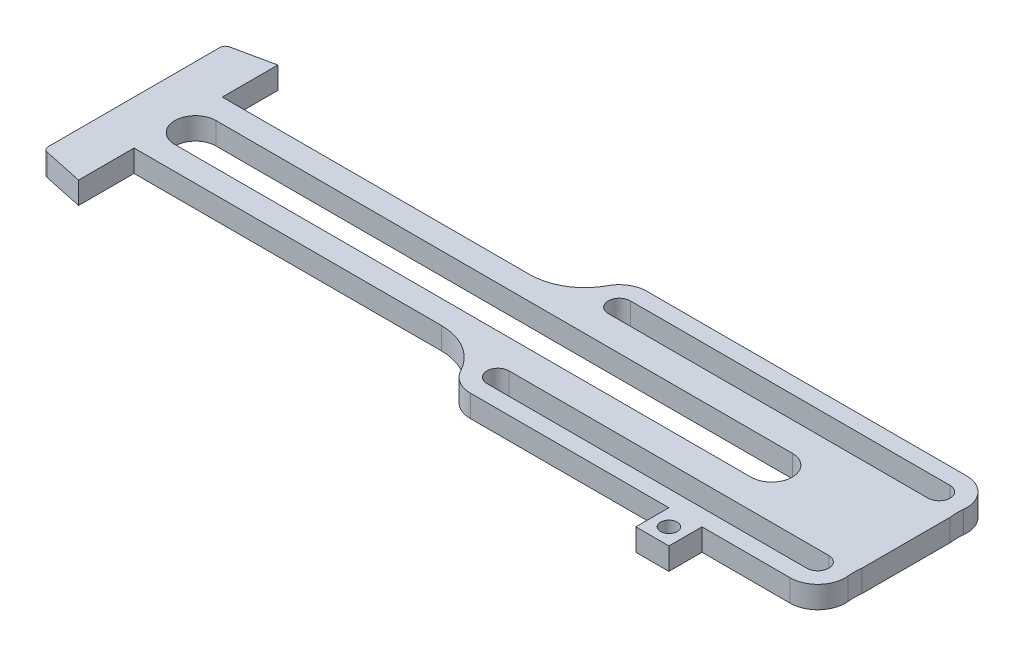
from build123d import *

# Parameters (mm, degrees)
EXTRUDE_1_DEPTH     = 4
EXTRUDE_2_DEPTH     = 4
FILLET_1_R          = 10
CUT_EXTRUDE_1_DEPTH = 142.340015565
SKETCH_4_W          = 6
SKETCH_4_H          = 6
EXTRUDE_7_DEPTH     = 4
SKETCH_6_R          = 1.5
CUT_EXTRUDE_4_DEPTH = 142.774468788
CUT_EXTRUDE_5_DEPTH = 142.774468788
FILLET_5_R          = 1
FILLET_6_R          = 1


with BuildPart() as part:
    # Эскиз1 → Бобышка-Вытянуть1 (new body)
    with BuildSketch(Plane(origin=(0, 0, 0), x_dir=(1, 0, 0), z_dir=(0, 1, 0))):
        Polygon((-140, -17), (-140, 17), (-138, 19), (-132, 19), (-132, 8), (0, 8), (0, -8), (-132, -8), (-132, -19), (-138, -19), align=None)
    extrude(amount=EXTRUDE_1_DEPTH)

    # Эскиз2 → Бобышка-Вытянуть2 (add)
    # profile 1 of 2: a face of its own
    with BuildSketch(Plane.XZ):
        with BuildLine():
            Line((-63, 16), (-5, 16))
            ThreePointArc((-5, 16), (0, 11), (-5, 6))
            Line((-5, 6), (-63, 6))
            ThreePointArc((-63, 6), (-68, 11), (-63, 16))
        make_face()
        with BuildLine():
            Line((-63, 13), (-5, 13))
            ThreePointArc((-5, 13), (-3, 11), (-5, 9))
            Line((-5, 9), (-63, 9))
            ThreePointArc((-63, 9), (-65, 11), (-63, 13))
        make_face(mode=Mode.SUBTRACT)
    # profile 2 of 2: a face of its own
    with BuildSketch(Plane.XZ):
        with BuildLine():
            Line((-63, -16), (-5, -16))
            ThreePointArc((-5, -16), (0, -11), (-5, -6))
            Line((-5, -6), (-63, -6))
            ThreePointArc((-63, -6), (-68, -11), (-63, -16))
        make_face()
        with BuildLine():
            Line((-63, -13), (-5, -13))
            ThreePointArc((-5, -13), (-3, -11), (-5, -9))
            Line((-5, -9), (-63, -9))
            ThreePointArc((-63, -9), (-65, -11), (-63, -13))
        make_face(mode=Mode.SUBTRACT)
    extrude(amount=-EXTRUDE_2_DEPTH)

    # Скругление1
    # the kernel refuses this fillet: 10 mm, written as the material it adds along each edge
    with BuildSketch(Plane(origin=(-1, 4, 8), x_dir=(1, 0, 0), z_dir=(0, -1, 0))) as fillet_1_piece_1:
        with BuildLine():
            CenterArc((10.90874153, 1.347902551), FILLET_1_R, 173.676623786, 14.069867748)
            Line((0.96958051, 2.44930085), (0.77079729, 2.471328816))
            ThreePointArc((0.77079729, 2.471328816), (0.463030841, 1.233264109), (-0.16, 0.12))
            Line((-0.16, 0.12), (0, -0.2))
            ThreePointArc((0, -0.2), (0.5, -0.2), (0.801825169, -0.026958051))
            Line((0.801825169, -0.026958051), (1, 0))
        make_face()
    extrude(amount=4)
    with BuildSketch(Plane(origin=(-67, 4, 8), x_dir=(-1, 0, 0), z_dir=(0, -1, 0))) as fillet_1_piece_2:
        with BuildLine():
            CenterArc((9.266499161, -10), FILLET_1_R, 90, 62.181860715)
            Line((0.422166387, -5.333333333), (0.245279732, -5.24))
            ThreePointArc((0.245279732, -5.24), (0.785032611, -2.621235013), (-0.16, -0.12))
            Line((-0.16, -0.12), (0, 0.2))
            Line((0, 0.2), (9.266499161, 0.2))
            Line((9.266499161, 0.2), (9.266499161, 0))
        make_face()
    extrude(amount=4)
    with BuildSketch(Plane(origin=(-1, 4, -8), x_dir=(1, 0, 0), z_dir=(0, -1, 0))) as fillet_1_piece_3:
        with BuildLine():
            CenterArc((10.90874153, -1.347902551), FILLET_1_R, 172.253508466, 14.069867748)
            Line((0.96958051, -2.44930085), (0.77079729, -2.471328816))
            ThreePointArc((0.77079729, -2.471328816), (0.463030841, -1.233264109), (-0.16, -0.12))
            Line((-0.16, -0.12), (0, 0.2))
            ThreePointArc((0, 0.2), (0.5, 0.2), (0.801825169, 0.026958051))
            Line((0.801825169, 0.026958051), (1, 0))
        make_face()
    extrude(amount=4)
    with BuildSketch(Plane(origin=(-67, 4, -8), x_dir=(-1, 0, 0), z_dir=(0, -1, 0))) as fillet_1_piece_4:
        with BuildLine():
            CenterArc((9.266499161, 10), FILLET_1_R, 207.818139285, 62.181860715)
            Line((0.422166387, 5.333333333), (0.245279732, 5.24))
            ThreePointArc((0.245279732, 5.24), (0.785032611, 2.621235013), (-0.16, 0.12))
            Line((-0.16, 0.12), (0, -0.2))
            Line((0, -0.2), (9.266499161, -0.2))
            Line((9.266499161, -0.2), (9.266499161, 0))
        make_face()
    extrude(amount=4)

    # Эскиз3 → Вырез-Вытянуть1 (cut, through all)
    with BuildSketch(Plane.XZ):
        with BuildLine():
            Line((-24.36067626, 3.753765504), (-128.863745401, 3.753765504))
            ThreePointArc((-128.863745401, 3.753765504), (-132.613745401, 0.003765504), (-128.863745401, -3.746234496))
            Line((-128.863745401, -3.746234496), (-24.36067626, -3.746234496))
            ThreePointArc((-24.36067626, -3.746234496), (-20.61067626, 0.003765504), (-24.36067626, 3.753765504))
        make_face()
    extrude(amount=-CUT_EXTRUDE_1_DEPTH, mode=Mode.SUBTRACT)

    # Эскиз4 → Бобышка-Вытянуть7 (add)
    with BuildSketch(Plane(origin=(0, 4, 0), x_dir=(1, 0, 0), z_dir=(0, 1, 0))):
        with Locations((-24, -19)):
            Rectangle(SKETCH_4_W, SKETCH_4_H)
    extrude(amount=-EXTRUDE_7_DEPTH)

    # Эскиз6 → Вырез-Вытянуть4 (cut, through all)
    with BuildSketch(Plane(origin=(0, 4, 0), x_dir=(1, 0, 0), z_dir=(0, 1, 0))):
        with Locations(Location((-24, -19, 0), (0, 0, 270))):
            Circle(SKETCH_6_R)
    extrude(amount=-CUT_EXTRUDE_4_DEPTH, mode=Mode.SUBTRACT)

    # Эскиз7 → Вырез-Вытянуть5 (cut, through all)
    with BuildSketch(Plane(origin=(0, 4, 0), x_dir=(1, 0, 0), z_dir=(0, 1, 0))):
        Polygon((-140, 16.36754244), (-131.974442882, 18.073427267), (-132, 19), (-138, 19), (-140, 17), align=None)
    cut_extrude_5 = extrude(amount=-CUT_EXTRUDE_5_DEPTH, mode=Mode.SUBTRACT)

    # Скругление5
    fillet_5_edges = [part.edges().sort_by_distance(p)[0] for p in [
        (-140, 2, -16.36754244),
    ]]
    fillet(fillet_5_edges, radius=FILLET_5_R)

    # Зеркальное отражение5: Вырез-Вытянуть5 across plane
    add(cut_extrude_5.mirror(Plane.XY), mode=Mode.SUBTRACT)

    # Скругление6
    fillet_6_edges = [part.edges().sort_by_distance(p)[0] for p in [
        (-140, 2, 16.36754244),
    ]]
    fillet(fillet_6_edges, radius=FILLET_6_R)


solid = part.part
